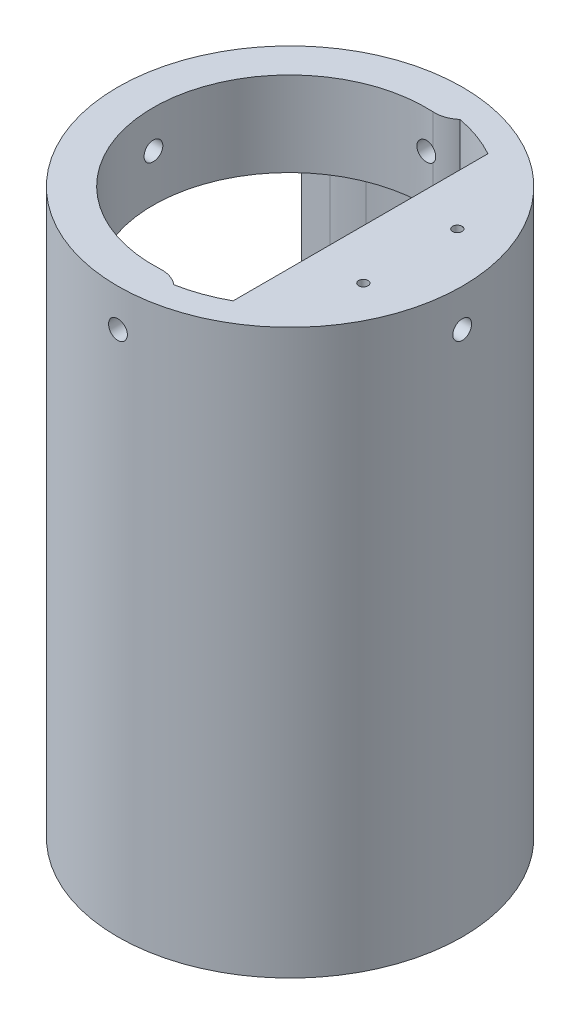
from build123d import *

# Parameters (mm, degrees)
SKETCH1_R                           = 46.608999999999995
BOSS_EXTRUDE1_DEPTH                 = 17.779999999999998
BOSS_EXTRUDE2_DEPTH                 = 134.61999999999998
BOSS_EXTRUDE5_START                 = -134.62
SKETCH9_R                           = 46.608999999999995
SKETCH9_R_2                         = 39.370000000000005
BOSS_EXTRUDE5_DEPTH                 = 134.62
CUT_EXTRUDE3_DEPTH                  = 154.68599999999998
SKETCH13_R                          = 1.269999999999998
CUT_EXTRUDE4_DEPTH                  = 12.700000000000001
CUT_EXTRUDE5_DEPTH                  = 5.08
CUT_EXTRUDE6_DEPTH                  = 2.54
FILLET1_R                           = 1.27
FILLET2_R                           = 20.32
BOSS_EXTRUDE6_START                 = -22.86
BOSS_EXTRUDE6_DEPTH                 = 22.86
CUT_EXTRUDE8_REACH                  = 168.044
CUT_EXTRUDE8_END_RADIUS             = 46.608999999999995
SKETCH15_R                          = 2.5400000000000054
CUT_EXTRUDE8_DIRECTION_2_REACH      = 168.044
CUT_EXTRUDE8_DIRECTION_2_END_RADIUS = 46.608999999999995
CUT_EXTRUDE7_REACH                  = 168.044
CUT_EXTRUDE7_END_RADIUS             = 46.608999999999995
SKETCH14_R                          = 2.5400000000000054
CUT_EXTRUDE7_DIRECTION_2_REACH      = 168.044
CUT_EXTRUDE7_DIRECTION_2_END_RADIUS = 46.608999999999995
FILLET4_R                           = 7.62


with BuildPart() as part:
    # Sketch1 → Boss-Extrude1 (new body)
    with BuildSketch(Plane(origin=(0, 0, 0), x_dir=(1, 0, 0), z_dir=(0, 1, 0))):
        with Locations(Location((0, 0, 0), (0, 0, 270))):
            Circle(SKETCH1_R)
    extrude(amount=BOSS_EXTRUDE1_DEPTH)

    # Sketch4 → Boss-Extrude2 (add)
    with BuildSketch(Plane(origin=(0, 17.779999999999998, 0), x_dir=(1, 0, 0), z_dir=(0, 1, 0))):
        with BuildLine():
            Line((19.050000000000008, 42.538175572067026), (19.050000000000008, -42.538175572067026))
            ThreePointArc((19.050000000000008, -42.538175572067026), (46.608999999999995, 0), (19.050000000000008, 42.538175572067026))
        make_face()
    extrude(amount=BOSS_EXTRUDE2_DEPTH)

    # Sketch9 → Boss-Extrude5 (add)
    with BuildSketch(Plane(origin=(0, 152.39999999999998, 0), x_dir=(1, 0, 0), z_dir=(0, 1, 0)).offset(BOSS_EXTRUDE5_START)):
        with Locations(Location((0, 0, 0), (0, 0, 90))):
            Circle(SKETCH9_R)
        Circle(SKETCH9_R_2, mode=Mode.SUBTRACT)
    extrude(amount=BOSS_EXTRUDE5_DEPTH)

    # Sketch11 → Cut-Extrude3 (cut)
    with BuildSketch(Plane.ZY.offset(-19.050000000000008)):
        Polygon((34.45423631427636, 220.61788202799335), (-34.45423631427636, 220.61788202799335), (-34.45423631427635, 154.94), (34.45423631427636, 154.94), align=None)
        Polygon((34.45423631427637, 129.54), (-34.45423631427636, 129.54), (-34.45423631427634, 50.43788202799334), (34.45423631427636, 50.437882027993346), align=None)
        Polygon((34.45423631427636, 50.437882027993346), (-34.45423631427634, 50.437882027993346), (-34.454236314276336, 17.779999999999994), (34.45423631427635, 17.77999999999999), align=None)
    extrude(amount=CUT_EXTRUDE3_DEPTH, mode=Mode.SUBTRACT)

    # Sketch13 → Cut-Extrude4 (cut)
    with BuildSketch(Plane(origin=(0, 152.39999999999998, 0), x_dir=(1, 0, 0), z_dir=(0, 1, 0))):
        with Locations(Location((32.512, -12.7, 0), (0, 0, 270))):
            Circle(SKETCH13_R)
        with Locations(Location((32.512, 12.7, 0), (0, 0, 270))):
            Circle(SKETCH13_R)
    extrude(amount=-CUT_EXTRUDE4_DEPTH, mode=Mode.SUBTRACT)

    # Sketch12 → Cut-Extrude5 (cut)
    with BuildSketch(Plane.ZY.offset(-19.050000000000008)):
        Polygon((-31.750000000000014, 147.31999999999996), (31.749999999999986, 147.31999999999996), (31.749999999999986, 121.91999999999994), (-31.75000000000002, 121.91999999999997), align=None)
    extrude(amount=-CUT_EXTRUDE5_DEPTH, mode=Mode.SUBTRACT)

    # Sketch5 → Cut-Extrude6 (cut)
    with BuildSketch(Plane.ZY.offset(-19.050000000000008)):
        Polygon((27.544814326386586, 23.734814326386505), (26.670000000000023, 24.09717428493421), (26.6699999999999, 22.86), (25.432825715065693, 22.86), (25.79518567361321, 21.985185673613508), (26.669999999999778, 21.622825715065805), (27.5448143263864, 21.985185673613323), (27.907174284934104, 22.859999999999882), align=None)
        Polygon((25.795185673613197, 113.90481432638651), (25.43282571506564, 113.02999999999992), (26.66999999999986, 113.02999999999999), (26.66999999999986, 111.79282571506582), (27.544814326386483, 112.15518567361349), (27.907174284934023, 113.0300000000001), (27.544814326386348, 113.90481432638664), (26.669999999999764, 114.26717428493419), align=None)
        Polygon((26.66999999999986, 113.02999999999999), (25.43282571506564, 113.02999999999999), (25.795185673613325, 112.15518567361335), (26.669999999999927, 111.79282571506582), align=None)
        Polygon((-26.670000000000137, 111.85760562527948), (-26.670000000000137, 113.02999999999999), (-25.401365710048424, 113.02999999999999), (-25.87901945792693, 114.02185822762273), (-26.95229768704921, 114.26682697962492), (-27.813000000000144, 113.58043978929702), (-27.813000000000137, 112.47956021070299), (-26.952297687049207, 111.7931730203751), align=None)
        Polygon((-25.401365710048424, 113.02999999999999), (-26.670000000000137, 113.02999999999999), (-26.670000000000137, 111.85760562527948), (-25.879019457926947, 112.03814177237726), align=None)
        Polygon((-25.795185673613584, 23.734814326386633), (-26.670000000000176, 24.09717428493421), (-26.670000000000147, 22.86), (-25.43282571506594, 22.860000000000007), align=None)
        Polygon((-26.670000000000147, 22.86), (-26.670000000000147, 24.097174284934212), (-27.54481432638676, 23.734814326386566), (-27.90717428493434, 22.859999999999964), (-27.544814326386703, 21.985185673613387), (-26.670000000000087, 21.622825715065805), (-25.79518567361352, 21.985185673613437), (-25.43282571506594, 22.860000000000042), align=None)
        Polygon((26.6699999999999, 22.86), (26.6699999999999, 24.097174284934212), (25.795185673613393, 23.734814326386687), (25.432825715065693, 22.860000000000127), align=None)
    extrude(amount=-CUT_EXTRUDE6_DEPTH, mode=Mode.SUBTRACT)

    # Fillet1
    # the kernel refuses this fillet: 1.27 mm, written as the material it takes off along each edge
    with BuildSketch(Plane(origin=(0, 17.779999999999998, 0), x_dir=(-0.621563096217022, 0, -0.7833641027141267), z_dir=(0.7833641027141267, 0, -0.621563096217022))) as fillet1_piece_1_section:
        with BuildLine():
            CenterArc((46.608999999999995 - FILLET1_R, -FILLET1_R), FILLET1_R, 0, 90.00000000000065)
            Line((46.608999999999995 - FILLET1_R, 0), (46.608999999999995, 0))
            Line((46.608999999999995, 0), (46.608999999999995, -FILLET1_R))
        make_face()
    fillet1_piece_1 = revolve(axis=Axis((0, 17.779999999999998, 0), (0, 1, 0)), revolution_arc=103.13925979363536, mode=Mode.PRIVATE)
    fillet1_piece_1 = split(fillet1_piece_1, bisect_by=Plane(origin=(0, 17.779999999999998, 34.45423631427636), z_dir=(0, 0, -1)), keep=Keep.TOP, mode=Mode.PRIVATE)
    fillet1_piece_1 = split(fillet1_piece_1, bisect_by=Plane(origin=(0, 17.779999999999994, -34.45423631427634), z_dir=(0, 9e-17, 1)), keep=Keep.TOP, mode=Mode.PRIVATE)
    add(fillet1_piece_1, mode=Mode.SUBTRACT)

    # Fillet2
    fillet2_edges = [part.edges().sort_by_distance(p)[0] for p in [
        (-19.050000000000015, 73.66, 34.45423631427636),
        (-19.050000000000058, 73.65999999999998, -34.454236314276336),
    ]]
    fillet(fillet2_edges, radius=FILLET2_R)

    # Sketch16 → Boss-Extrude6 (add)
    with BuildSketch(Plane(origin=(0, 152.39999999999998, 0), x_dir=(1, 0, 0), z_dir=(0, 1, 0)).offset(BOSS_EXTRUDE6_START)):
        with BuildLine():
            Line((7.239965416965475, 36.15857621103319), (7.239965416965475, 38.69857621103319))
            ThreePointArc((7.239965416965475, 38.6985762110332), (3.6355160962112594, 39.2017846878709), (-1.3678e-13, 39.370000000000005))
            ThreePointArc((-1.3746e-13, 39.370000000000005), (-39.370000000000005, -2.767e-13), (4.1593e-13, -39.370000000000005))
            ThreePointArc((4.13e-13, -39.370000000000005), (3.635516096211516, -39.201784687870884), (7.239965416965463, -38.69857621103321))
            Line((7.239965416965475, -38.698576211033206), (7.239965416965475, -36.1585762110332))
            ThreePointArc((7.239965416965489, -36.158576211033186), (-37.032156348970574, -3.55e-15), (7.239965416965477, 36.15857621103319))
        make_face()
    extrude(amount=BOSS_EXTRUDE6_DEPTH)

    # Cut-Extrude8: up to this cylinder (the profile starts inside it)
    cut_extrude8_end = Plane(origin=(0, 142.24, 0), z_dir=(0, -1, 0)) * Cylinder(CUT_EXTRUDE8_END_RADIUS, 430.30600000000004, mode=Mode.PRIVATE)
    # Sketch15 → Cut-Extrude8 (cut, up to the surface)
    with BuildSketch(Plane.XY, mode=Mode.PRIVATE) as cut_extrude8_sk1:
        with Locations((0, 142.23999999999998)):
            Circle(SKETCH15_R)
    cut_extrude8_tool1 = extrude(cut_extrude8_sk1.sketch, amount=-CUT_EXTRUDE8_REACH, mode=Mode.PRIVATE) & cut_extrude8_end
    add(cut_extrude8_tool1.solids().sort_by_distance((0, 142.24, 0))[0], mode=Mode.SUBTRACT)

    # Cut-Extrude8 direction 2: up to this cylinder (the profile starts inside it)
    cut_extrude8_direction_2_end = Plane(origin=(0, 142.24, 0), z_dir=(0, -1, 0)) * Cylinder(CUT_EXTRUDE8_DIRECTION_2_END_RADIUS, 430.30600000000004, mode=Mode.PRIVATE)
    # Sketch15 → Cut-Extrude8 direction 2 (cut, up to the surface)
    with BuildSketch(Plane.XY, mode=Mode.PRIVATE) as cut_extrude8_direction_2_sk1:
        with Locations((0, 142.23999999999998)):
            Circle(SKETCH15_R)
    cut_extrude8_direction_2_tool1 = extrude(cut_extrude8_direction_2_sk1.sketch, amount=CUT_EXTRUDE8_DIRECTION_2_REACH, mode=Mode.PRIVATE) & cut_extrude8_direction_2_end
    add(cut_extrude8_direction_2_tool1.solids().sort_by_distance((0, 142.24, 0))[0], mode=Mode.SUBTRACT)

    # Cut-Extrude7: up to this cylinder (the profile starts inside it)
    cut_extrude7_end = Plane(origin=(0, 142.24, 0), z_dir=(0, -1, 0)) * Cylinder(CUT_EXTRUDE7_END_RADIUS, 430.30600000000004, mode=Mode.PRIVATE)
    # Sketch14 → Cut-Extrude7 (cut, up to the surface)
    with BuildSketch(Plane(origin=(0, 0, 0), x_dir=(0, 0, -1), z_dir=(1, 0, 0)), mode=Mode.PRIVATE) as cut_extrude7_sk1:
        with Locations((0, 142.23999999999998)):
            Circle(SKETCH14_R)
    cut_extrude7_tool1 = extrude(cut_extrude7_sk1.sketch, amount=-CUT_EXTRUDE7_REACH, mode=Mode.PRIVATE) & cut_extrude7_end
    add(cut_extrude7_tool1.solids().sort_by_distance((0, 142.24, 0))[0], mode=Mode.SUBTRACT)

    # Cut-Extrude7 direction 2: up to this cylinder (the profile starts inside it)
    cut_extrude7_direction_2_end = Plane(origin=(0, 142.24, 0), z_dir=(0, -1, 0)) * Cylinder(CUT_EXTRUDE7_DIRECTION_2_END_RADIUS, 430.30600000000004, mode=Mode.PRIVATE)
    # Sketch14 → Cut-Extrude7 direction 2 (cut, up to the surface)
    with BuildSketch(Plane(origin=(0, 0, 0), x_dir=(0, 0, -1), z_dir=(1, 0, 0)), mode=Mode.PRIVATE) as cut_extrude7_direction_2_sk1:
        with Locations((0, 142.23999999999998)):
            Circle(SKETCH14_R)
    cut_extrude7_direction_2_tool1 = extrude(cut_extrude7_direction_2_sk1.sketch, amount=CUT_EXTRUDE7_DIRECTION_2_REACH, mode=Mode.PRIVATE) & cut_extrude7_direction_2_end
    add(cut_extrude7_direction_2_tool1.solids().sort_by_distance((0, 142.24, 0))[0], mode=Mode.SUBTRACT)

    # Fillet4
    # the kernel refuses this fillet: 7.62 mm, written as the material it takes off along each edge
    with BuildSketch(Plane(origin=(7.239965416965482, 115.93873282351406, 36.15857621103319), x_dir=(-0.9919095847331534, 0, 0.12694634974863653), z_dir=(0, 1, 0))) as fillet4_piece_1:
        with BuildLine():
            CenterArc((6.002219177503209, 7.599268338745982), FILLET4_R, 221.8084788456623, 43.96409810671878)
            Line((0.3224437283615526, 2.519450345222228), (0, 0))
            ThreePointArc((0, 0), (2.7202534352971823, 0.10039903354798235), (5.440506870594364, -6e-17))
        make_face()
    extrude(amount=50.06253435297181, mode=Mode.SUBTRACT)
    with BuildSketch(Plane(origin=(7.239965416965472, 115.93873282351416, -36.15857621103319), x_dir=(2.8e-15, 0, -1), z_dir=(0, 1, 0))) as fillet4_piece_2:
        with BuildLine():
            CenterArc((8.29974691713661, 4.988959355470371), FILLET4_R, 176.93425409851847, 43.96409810671855)
            ThreePointArc((0.690652488004317, 5.396490910749089), (0.4449130076763477, 2.685500164547348), (0, 0))
            Line((0, 0), (2.539999999999999, 0))
        make_face()
    extrude(amount=50.062534352971625, mode=Mode.SUBTRACT)


solid = part.part
